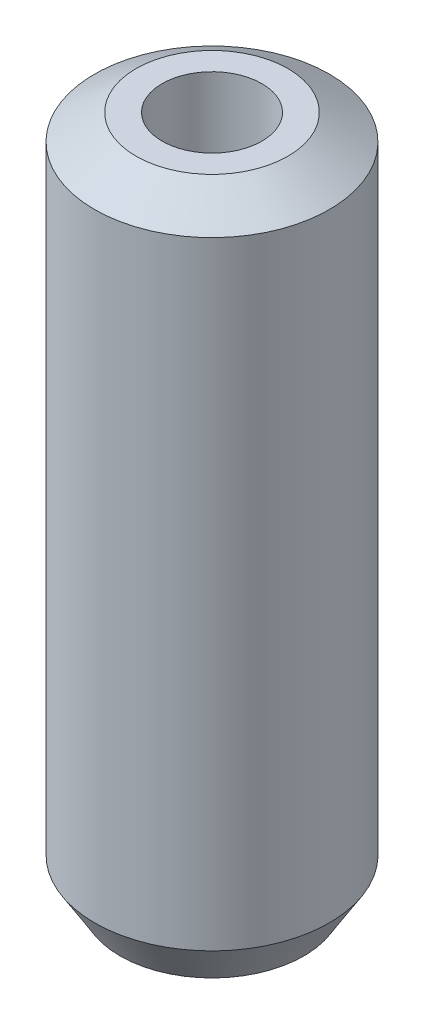
from build123d import *
from OCP.BRepFilletAPI import BRepFilletAPI_MakeChamfer

# Parameters (mm, degrees)
SKETCH1_R           = 5
BOSS_EXTRUDE1_DEPTH = 29.164139439
SKETCH2_R           = 2.124510138
CUT_EXTRUDE1_DEPTH  = 31.009115768
CHAMFER1_SIZE       = 1.08478845
CHAMFER1_SIZE2      = 1.765364578


with BuildPart() as part:
    # Sketch1 → Boss-Extrude1 (new body)
    with BuildSketch(Plane(origin=(0, 0, 0), x_dir=(1, 0, 0), z_dir=(0, 1, 0))):
        Circle(SKETCH1_R)
    extrude(amount=BOSS_EXTRUDE1_DEPTH)

    # Sketch2 → Cut-Extrude1 (cut, through all)
    with BuildSketch(Plane(origin=(0, 0, 0), x_dir=(1, 0, 0), z_dir=(0, 1, 0))):
        Circle(SKETCH2_R)
    extrude(amount=CUT_EXTRUDE1_DEPTH, mode=Mode.SUBTRACT)

    # Chamfer1: one chamfer whose edges measure the first distance from different faces: ONE call of the kernel's chamfer builder (chamfer() names one face for all edges)
    chamfer1_edges_1 = [part.edges().sort_by_distance(p)[0] for p in [
        (-5, 29.164139439, 0),
    ]]
    chamfer1_side_1 = [part.faces().sort_by_distance(p)[0] for p in [
        (-5, 14.582069719, 0),
    ]]
    chamfer1_edges_2 = [part.edges().sort_by_distance(p)[0] for p in [
        (-5, 0, 0),
    ]]
    chamfer1_side_2 = [part.faces().sort_by_distance(p)[0] for p in [
        (-4.858578644, 0, 0),
    ]]
    chamfer1 = BRepFilletAPI_MakeChamfer(part.part.solid().wrapped)
    for e in chamfer1_edges_1:
        chamfer1.Add(CHAMFER1_SIZE, CHAMFER1_SIZE2, e.wrapped, chamfer1_side_1[0].wrapped)  # the first distance lies on this face
    for e in chamfer1_edges_2:
        chamfer1.Add(CHAMFER1_SIZE, CHAMFER1_SIZE2, e.wrapped, chamfer1_side_2[0].wrapped)  # the first distance lies on this face
    add(Compound.cast(chamfer1.Shape()), mode=Mode.REPLACE)


solid = part.part
